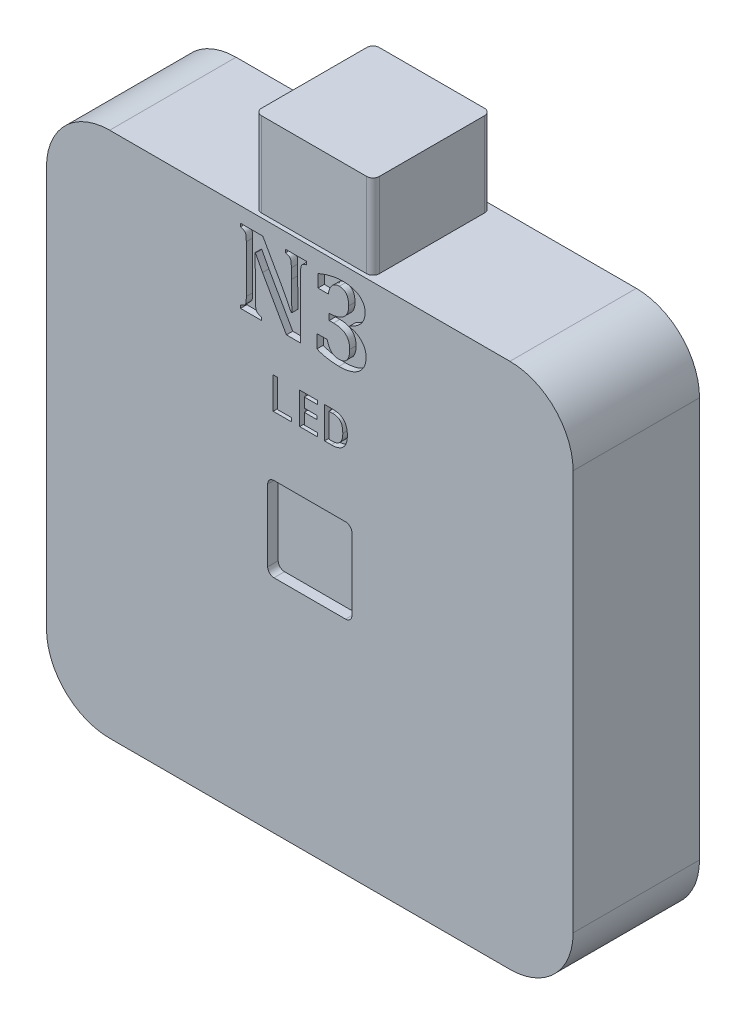
from build123d import *

# Parameters (mm, degrees)
MAIN_P_DEPTH     = 3
LED_P_DEPTH      = 0.5
N3_LED_P_DEPTH   = 0.3
CABLE_UP_P_DEPTH = 4
USB_P_DEPTH      = 5


with BuildPart() as part:
    # Main → Main_P (new, symmetric)
    with BuildSketch(Plane.XY):
        with BuildLine():
            Line((-12.5, 9.5), (-12.5, -9.5))
            ThreePointArc((-12.5, -9.5), (-11.621320344, -11.621320344), (-9.5, -12.5))
            Line((-9.5, -12.5), (9.5, -12.5))
            ThreePointArc((9.5, -12.5), (11.621320344, -11.621320344), (12.5, -9.5))
            Line((12.5, -9.5), (12.5, 9.5))
            ThreePointArc((12.5, 9.5), (11.621320344, 11.621320344), (9.5, 12.5))
            Line((9.5, 12.5), (-9.5, 12.5))
            ThreePointArc((-9.5, 12.5), (-11.621320344, 11.621320344), (-12.5, 9.5))
        make_face()
    extrude(amount=MAIN_P_DEPTH, both=True)

    # LED → LED_P (cut)
    with BuildSketch(Plane.XY.offset(3)):
        with BuildLine():
            ThreePointArc((-1.7, 2), (-1.912132034, 1.912132034), (-2, 1.7))
            Line((-2, 1.7), (-2, -1.7))
            ThreePointArc((-2, -1.7), (-1.912132034, -1.912132034), (-1.7, -2))
            Line((-1.7, -2), (1.7, -2))
            ThreePointArc((1.7, -2), (1.912132034, -1.912132034), (2, -1.7))
            Line((2, -1.7), (2, 1.7))
            ThreePointArc((2, 1.7), (1.912132034, 1.912132034), (1.7, 2))
            Line((1.7, 2), (-1.7, 2))
        make_face()
    extrude(amount=-LED_P_DEPTH, mode=Mode.SUBTRACT)

    # 草图3 → N3_LED_P (cut)
    # profile 1 of 5: a face of its own
    with BuildSketch(Plane.XY.offset(3)):
        with BuildLine():
            Line((-0.161653646, 11.781109518), (-0.161653646, 11.635276185))
            add(Edge.make_bspline(
                [(-0.161653646, 11.635276185), (-0.177669577, 11.630143703), (-0.207122243, 11.62070527), (-0.246900488, 11.605079733), (-0.279469724, 11.591737774), (-0.312906932, 11.575932284), (-0.347427448, 11.553100688), (-0.382321405, 11.516267884), (-0.408955266, 11.463747633), (-0.422918392, 11.407823862), (-0.431549055, 11.351158658), (-0.435554473, 11.295811772), (-0.438778121, 11.230222428), (-0.438850306, 11.182844202), (-0.438888889, 11.157520108)],
                knots=[0, 0, 0, 0, 0.975471235, 1.79385316, 2.478592115, 3.017303699, 3.938041953, 4.862988783, 5.927517867, 7.313751775, 8.190433857, 9.251714942, 10.531016607, 12, 12, 12, 12], degree=3))
            Line((-0.438888889, 11.157520108), (-0.438888889, 8.281109518))
            Line((-0.438888889, 8.281109518), (-1.109570312, 8.281109518))
            Line((-1.109570312, 8.281109518), (-2.243576389, 10.276443719))
            add(Edge.make_bspline(
                [(-2.243576389, 10.276443719), (-2.262061977, 10.30935546), (-2.297864844, 10.373098887), (-2.349981257, 10.466014814), (-2.397397164, 10.553857645), (-2.44170538, 10.636006813), (-2.48201379, 10.712701344), (-2.518234642, 10.783968671), (-2.551426649, 10.84954286), (-2.571291416, 10.891884411), (-2.580815972, 10.912185907)],
                knots=[0, 0, 0, 0, 1.258598321, 2.437651948, 3.551981321, 4.586832213, 5.549698172, 6.440681917, 7.252354063, 8, 8, 8, 8], degree=3))
            Line((-2.580815972, 10.912185907), (-2.603602431, 10.912185907))
            add(Edge.make_bspline(
                [(-2.603602431, 10.912185907), (-2.599591716, 10.81800995), (-2.59147488, 10.627417745), (-2.583113042, 10.337504552), (-2.578672736, 10.039985491), (-2.578078581, 9.838945123), (-2.577777778, 9.737164205)],
                knots=[0, 0, 0, 0, 0.96232484, 1.947541814, 2.960899847, 4, 4, 4, 4], degree=3))
            Line((-2.577777778, 9.737164205), (-2.577777778, 8.90317983))
            add(Edge.make_bspline(
                [(-2.577777778, 8.90317983), (-2.577360248, 8.873305826), (-2.576592183, 8.81835119), (-2.574303843, 8.743023002), (-2.568298325, 8.682170292), (-2.558638799, 8.621966077), (-2.535177858, 8.562565398), (-2.499072994, 8.513092269), (-2.457295753, 8.483552474), (-2.414642197, 8.463699144), (-2.361461312, 8.444163617), (-2.321902365, 8.432980934), (-2.300542535, 8.426942851)],
                knots=[0, 0, 0, 0, 1.438978439, 2.647068478, 3.627372042, 4.383140196, 5.576371536, 6.671434312, 7.273846566, 8.020909247, 8.931391092, 10, 10, 10, 10], degree=3))
            Line((-2.300542535, 8.426942851), (-2.300542535, 8.281109518))
            Line((-2.300542535, 8.281109518), (-3.289474826, 8.281109518))
            Line((-3.289474826, 8.281109518), (-3.289474826, 8.426942851))
            add(Edge.make_bspline(
                [(-3.289474826, 8.426942851), (-3.260887566, 8.435405948), (-3.209575028, 8.450596734), (-3.141898216, 8.480225141), (-3.089109373, 8.517166522), (-3.054582463, 8.569155916), (-3.031805913, 8.631573888), (-3.021267721, 8.708155169), (-3.015577407, 8.800531184), (-3.015384102, 8.86822464), (-3.015277778, 8.905458476)],
                knots=[0, 0, 0, 0, 1.149089374, 2.062551405, 2.843955622, 3.594533422, 4.429073491, 5.389328747, 6.564036866, 8, 8, 8, 8], degree=3))
            Line((-3.015277778, 8.905458476), (-3.015277778, 11.15676056))
            add(Edge.make_bspline(
                [(-3.015277778, 11.15676056), (-3.015325243, 11.186892755), (-3.015411829, 11.241859483), (-3.018334, 11.316860805), (-3.023087242, 11.376518256), (-3.032403199, 11.435206702), (-3.054104254, 11.494869379), (-3.091783318, 11.544237582), (-3.134117609, 11.575394999), (-3.176190741, 11.598027263), (-3.229205053, 11.618124618), (-3.268362891, 11.629268152), (-3.289474826, 11.635276185)],
                knots=[0, 0, 0, 0, 1.453211759, 2.650928568, 3.61941141, 4.338124492, 5.512963293, 6.643955544, 7.271627919, 8.036671964, 8.941472357, 10, 10, 10, 10], degree=3))
            Line((-3.289474826, 11.635276185), (-3.289474826, 11.781109518))
            Line((-3.289474826, 11.781109518), (-2.231423611, 11.781109518))
            Line((-2.231423611, 11.781109518), (-1.341232639, 10.204286601))
            add(Edge.make_bspline(
                [(-1.341232639, 10.204286601), (-1.326281235, 10.177203726), (-1.29419107, 10.119075811), (-1.242753958, 10.025182062), (-1.186516622, 9.917693152), (-1.103399271, 9.760024352), (-1.000819197, 9.561493992), (-0.925038386, 9.400153632), (-0.888541667, 9.322450664)],
                knots=[0, 0, 0, 0, 0.561655796, 1.205480602, 1.943652644, 2.764033489, 4.441529425, 6, 6, 6, 6], degree=3))
            Line((-0.888541667, 9.322450664), (-0.84828559, 9.322450664))
            add(Edge.make_bspline(
                [(-0.84828559, 9.322450664), (-0.852568567, 9.42801973), (-0.86132807, 9.643928572), (-0.870286692, 9.974860117), (-0.875728167, 10.319972333), (-0.876165667, 10.554689597), (-0.876388889, 10.674447192)],
                knots=[0, 0, 0, 0, 0.937488971, 1.917343447, 2.937385629, 4, 4, 4, 4], degree=3))
            Line((-0.876388889, 10.674447192), (-0.876388889, 11.156001011))
            add(Edge.make_bspline(
                [(-0.876388889, 11.156001011), (-0.8765491, 11.182077908), (-0.876846263, 11.230445989), (-0.878584804, 11.297370597), (-0.88341317, 11.352551665), (-0.889470731, 11.40804868), (-0.902414163, 11.461838736), (-0.926402611, 11.513437364), (-0.960023933, 11.5513147), (-0.994463834, 11.575841901), (-1.029168865, 11.592604982), (-1.062773812, 11.606857189), (-1.104258254, 11.621111424), (-1.134351907, 11.630312605), (-1.150585937, 11.635276185)],
                knots=[0, 0, 0, 0, 1.50660748, 2.794493175, 3.865833101, 4.705810794, 6.018377177, 7.045366401, 7.95762345, 8.91149549, 9.467497486, 10.181957038, 11.019256184, 12, 12, 12, 12], degree=3))
            Line((-1.150585937, 11.635276185), (-1.150585937, 11.781109518))
            Line((-1.150585937, 11.781109518), (-0.161653646, 11.781109518))
        make_face()
    # profile 2 of 5: a face of its own
    with BuildSketch(Plane.XY.offset(3)):
        with BuildLine():
            Line((0.3875, 10.954720629), (0.3875, 11.55552358))
            add(Edge.make_bspline(
                [(0.3875, 11.55552358), (0.440740019, 11.577509227), (0.544910562, 11.620526806), (0.701382153, 11.67600796), (0.853924181, 11.723162671), (1.002588814, 11.762188687), (1.147644136, 11.791995458), (1.288859262, 11.813238903), (1.426551741, 11.826815623), (1.517172623, 11.82876262), (1.561762153, 11.829720629)],
                knots=[0, 0, 0, 0, 1.138871734, 2.228340433, 3.281437788, 4.295392059, 5.266464412, 6.20817041, 7.11833965, 8, 8, 8, 8], degree=3))
            add(Edge.make_bspline(
                [(1.561762153, 11.829720629), (1.612700862, 11.828818436), (1.711831349, 11.827062702), (1.855946997, 11.810043084), (1.991078637, 11.782324938), (2.116218264, 11.742896491), (2.230784195, 11.693991601), (2.332778472, 11.634502441), (2.419627815, 11.562468262), (2.493671249, 11.481886216), (2.55197375, 11.390384121), (2.594306505, 11.289862871), (2.619025084, 11.17971571), (2.62204951, 11.103465747), (2.623611111, 11.064095629)],
                knots=[0, 0, 0, 0, 1.245991689, 2.424791773, 3.545045706, 4.616816666, 5.629595787, 6.587952593, 7.494614438, 8.380594144, 9.255347842, 10.135547138, 11.037327689, 12, 12, 12, 12], degree=3))
            add(Edge.make_bspline(
                [(2.623611111, 11.064095629), (2.622735968, 11.028066694), (2.621031018, 10.957875282), (2.60351275, 10.856007142), (2.57681259, 10.760264172), (2.537203389, 10.67174744), (2.48900985, 10.589026607), (2.431899461, 10.51188363), (2.364854414, 10.440894183), (2.289034787, 10.374315574), (2.202470426, 10.311815885), (2.105401044, 10.250288114), (1.996821144, 10.188580227), (1.91897061, 10.150440372), (1.878493924, 10.130610386)],
                knots=[0, 0, 0, 0, 1.018223358, 1.983698243, 2.915322269, 3.82284993, 4.718315375, 5.619291428, 6.531357531, 7.475260989, 8.469397413, 9.548207294, 10.725243872, 12, 12, 12, 12], degree=3))
            Line((1.878493924, 10.130610386), (1.878493924, 10.107823928))
            add(Edge.make_bspline(
                [(1.878493924, 10.107823928), (1.914332461, 10.100573361), (1.985268492, 10.086222149), (2.088345737, 10.054417236), (2.185825078, 10.011929471), (2.278699343, 9.962321579), (2.364496749, 9.903470268), (2.441580147, 9.834864416), (2.509481243, 9.757209764), (2.567266491, 9.670081548), (2.614853742, 9.575293169), (2.648343733, 9.472147921), (2.668374432, 9.361713423), (2.670917252, 9.285571619), (2.672222222, 9.246495803)],
                knots=[0, 0, 0, 0, 1.026010526, 2.030805963, 3.020916541, 4.0067071, 4.98253303, 5.933933234, 6.895997563, 7.869724968, 8.861364754, 9.863719257, 10.903665134, 12, 12, 12, 12], degree=3))
            add(Edge.make_bspline(
                [(2.672222222, 9.246495803), (2.670475833, 9.198772508), (2.66704771, 9.105092709), (2.639892184, 8.96867947), (2.594916044, 8.840381305), (2.541926714, 8.741209427), (2.491221993, 8.666758497), (2.448082435, 8.614099673), (2.400660821, 8.563973017), (2.347753383, 8.517937264), (2.291156171, 8.473615925), (2.229135573, 8.433475264), (2.162916446, 8.396210352), (2.067455524, 8.350000016), (1.936808858, 8.301935023), (1.766553096, 8.261373754), (1.580692314, 8.237026181), (1.451703991, 8.234044991), (1.384787326, 8.232498407)],
                knots=[0, 0, 0, 0, 1.238691166, 2.431524098, 3.596131476, 4.758044184, 5.339846471, 5.93341988, 6.524072501, 7.129652346, 7.75306838, 8.389559096, 9.046112197, 9.725450149, 11.142277535, 12.650970423, 14.262587788, 16, 16, 16, 16], degree=3))
            add(Edge.make_bspline(
                [(1.384787326, 8.232498407), (1.33716922, 8.233000944), (1.242335341, 8.234001772), (1.100704382, 8.244589066), (0.960201974, 8.260012504), (0.822458508, 8.283105417), (0.689307329, 8.310166445), (0.564478721, 8.345095257), (0.447273325, 8.381722131), (0.374357917, 8.413166248), (0.338888889, 8.428461949)],
                knots=[0, 0, 0, 0, 1.066585531, 2.124159315, 3.180226203, 4.232065357, 5.252166273, 6.22223498, 7.135222593, 8, 8, 8, 8], degree=3))
            Line((0.338888889, 8.428461949), (0.338888889, 9.058887296))
            Line((0.338888889, 9.058887296), (0.825, 9.058887296))
            add(Edge.make_bspline(
                [(0.825, 9.058887296), (0.837189747, 9.015014079), (0.860202393, 8.932187192), (0.907565053, 8.819827773), (0.960730451, 8.725473619), (1.023417455, 8.650027003), (1.096067092, 8.592546026), (1.17921829, 8.55307138), (1.27189704, 8.527622129), (1.337265875, 8.52534449), (1.371115451, 8.524165074)],
                knots=[0, 0, 0, 0, 1.305930177, 2.46542516, 3.491309853, 4.404185451, 5.263440125, 6.128056862, 7.030662191, 8, 8, 8, 8], degree=3))
            add(Edge.make_bspline(
                [(1.371115451, 8.524165074), (1.392164121, 8.524433805), (1.433176166, 8.524957413), (1.492609065, 8.53390272), (1.548059007, 8.546568938), (1.599916425, 8.563781846), (1.646929411, 8.587859054), (1.690785253, 8.615684602), (1.729796272, 8.649783266), (1.765072714, 8.688559859), (1.795252278, 8.733144058), (1.822079278, 8.782170178), (1.84498521, 8.836294062), (1.86284081, 8.89598753), (1.877484799, 8.960655912), (1.886829861, 9.030567503), (1.893110212, 9.1053591), (1.893990014, 9.156854944), (1.894444444, 9.183453268)],
                knots=[0, 0, 0, 0, 1.04932923, 2.044553753, 2.991534269, 3.886518749, 4.762302477, 5.620875306, 6.471885114, 7.33961212, 8.229767994, 9.151377203, 10.125200033, 11.156267991, 12.256683227, 13.430583075, 14.672860224, 16, 16, 16, 16], degree=3))
            add(Edge.make_bspline(
                [(1.894444444, 9.183453268), (1.893923242, 9.212094329), (1.89291031, 9.267756915), (1.883337619, 9.348187978), (1.86974041, 9.423238576), (1.847881869, 9.491942686), (1.821530947, 9.555576976), (1.788878631, 9.613655138), (1.749657985, 9.66586494), (1.704456283, 9.71249025), (1.653392593, 9.753918462), (1.595481177, 9.788663397), (1.532454678, 9.819445748), (1.462480649, 9.84356268), (1.386682245, 9.862203917), (1.304717529, 9.876142531), (1.216545131, 9.883216945), (1.155667314, 9.884575397), (1.124262153, 9.885276185)],
                knots=[0, 0, 0, 0, 1.148071931, 2.231225072, 3.24480356, 4.201827953, 5.116438562, 6.003060875, 6.866114256, 7.727792825, 8.601530905, 9.494871905, 10.430378815, 11.409816751, 12.456422708, 13.558120058, 14.740302521, 16, 16, 16, 16], degree=3))
            Line((1.124262153, 9.885276185), (0.922222222, 9.885276185))
            Line((0.922222222, 9.885276185), (0.922222222, 10.176942851))
            add(Edge.make_bspline(
                [(0.922222222, 10.176942851), (0.958968977, 10.179047578), (1.030367567, 10.183137041), (1.133861524, 10.196149192), (1.23055265, 10.214228929), (1.320626575, 10.237464771), (1.403485769, 10.267000531), (1.479437046, 10.302240842), (1.548758592, 10.342427601), (1.611744672, 10.387864156), (1.666592564, 10.440159976), (1.714960843, 10.497177798), (1.755313557, 10.560217187), (1.789037602, 10.628097219), (1.814991128, 10.701808441), (1.832889709, 10.780828418), (1.84365028, 10.865304662), (1.845090515, 10.92329325), (1.845833333, 10.953201532)],
                knots=[0, 0, 0, 0, 1.294124326, 2.514471056, 3.665273782, 4.75157949, 5.782351101, 6.754339568, 7.691995305, 8.596689159, 9.478484644, 10.35060716, 11.219952716, 12.103948147, 13.010742687, 13.961079669, 14.948403386, 16, 16, 16, 16], degree=3))
            add(Edge.make_bspline(
                [(1.845833333, 10.953201532), (1.845601673, 10.976502984), (1.845150288, 11.021905495), (1.839954798, 11.087649363), (1.83057941, 11.148966268), (1.818822186, 11.205961214), (1.803003196, 11.258682836), (1.782835695, 11.306707618), (1.760733292, 11.351079808), (1.73337706, 11.389994358), (1.704254924, 11.425255015), (1.670709149, 11.455221946), (1.634583481, 11.481320037), (1.594305126, 11.501550057), (1.551844133, 11.518784688), (1.505510174, 11.529871196), (1.456147632, 11.536840966), (1.422030494, 11.537642794), (1.40453559, 11.538053962)],
                knots=[0, 0, 0, 0, 1.342415624, 2.615675512, 3.795773904, 4.914495864, 5.966655767, 6.960891649, 7.913479791, 8.815817395, 9.695585522, 10.542445334, 11.400538855, 12.255277765, 13.132987386, 14.03520706, 14.992475158, 16, 16, 16, 16], degree=3))
            add(Edge.make_bspline(
                [(1.40453559, 11.538053962), (1.384491939, 11.53754342), (1.344910756, 11.536535226), (1.286744903, 11.526292289), (1.230852682, 11.509562789), (1.177220657, 11.485709854), (1.12508323, 11.454589705), (1.077488635, 11.411845023), (1.032105503, 11.360106931), (0.989775583, 11.298597965), (0.951803541, 11.227101967), (0.920110747, 11.145095851), (0.892637928, 11.053754417), (0.880107507, 10.9885341), (0.873611111, 10.954720629)],
                knots=[0, 0, 0, 0, 0.831492998, 1.641990067, 2.443438678, 3.248189408, 4.073881454, 4.952981561, 5.891417605, 6.926545987, 8.045740153, 9.244265423, 10.571289508, 12, 12, 12, 12], degree=3))
            Line((0.873611111, 10.954720629), (0.3875, 10.954720629))
        make_face()
    # profile 3 of 5: a face of its own
    with BuildSketch(Plane.XY.offset(3)):
        Polygon((-0.869565217, 4.825678085), (-1.739130435, 4.825678085), (-1.739130435, 6.325678085), (-1.52173913, 6.325678085), (-1.52173913, 4.999591128), (-0.869565217, 4.999591128), align=None)
    # profile 4 of 5: a face of its own
    with BuildSketch(Plane.XY.offset(3)):
        Polygon((0.369565217, 4.825678085), (-0.47826087, 4.825678085), (-0.47826087, 6.325678085), (0.369565217, 6.325678085), (0.369565217, 6.151765041), (-0.260869565, 6.151765041), (-0.260869565, 5.695243302), (0.344429348, 5.695243302), (0.344429348, 5.521330259), (-0.260869565, 5.521330259), (-0.260869565, 4.999591128), (0.369565217, 4.999591128), align=None)
    # profile 5 of 5: a face of its own
    with BuildSketch(Plane.XY.offset(3)):
        with BuildLine():
            add(Edge.make_bspline(
                [(1.782608696, 5.592322107), (1.781881693, 5.557071296), (1.780453249, 5.487809132), (1.769639022, 5.402697551), (1.757030821, 5.337344625), (1.744778972, 5.290636145), (1.730148703, 5.245451149), (1.712869427, 5.202118691), (1.693087326, 5.160443807), (1.670777532, 5.120529234), (1.645105156, 5.082959727), (1.617340404, 5.046999069), (1.586239261, 5.013529079), (1.55176278, 4.982547568), (1.513983946, 4.953939128), (1.472709687, 4.928053631), (1.428019143, 4.905147805), (1.380326169, 4.884093241), (1.328856141, 4.866699984), (1.273999358, 4.851672582), (1.215487151, 4.839669642), (1.153019868, 4.83187259), (1.086821989, 4.826554805), (1.041338254, 4.825975367), (1.018002717, 4.825678085)],
                knots=[0, 0, 0, 0, 1.874627119, 3.68334034, 4.55511198, 5.414139205, 6.25033141, 7.080252411, 7.893905149, 8.703019486, 9.509911256, 10.312362027, 11.117881282, 11.936734267, 12.775179546, 13.635831221, 14.524848569, 15.444673208, 16.406604644, 17.411911457, 18.469143348, 19.580838344, 20.758843452, 22, 22, 22, 22], degree=3))
            Line((1.018002717, 4.825678085), (0.695652174, 4.825678085))
            Line((0.695652174, 4.825678085), (0.695652174, 6.325678085))
            Line((0.695652174, 6.325678085), (1.083559783, 6.325678085))
            add(Edge.make_bspline(
                [(1.083559783, 6.325678085), (1.112000472, 6.325210637), (1.167205562, 6.324303293), (1.247203115, 6.315771362), (1.321614986, 6.30153098), (1.390592594, 6.282111252), (1.453838666, 6.256436711), (1.511742055, 6.225622096), (1.563859575, 6.188578649), (1.610414006, 6.145786933), (1.651504473, 6.097246892), (1.686641012, 6.042511604), (1.716612678, 5.982038736), (1.741038601, 5.915527283), (1.759476359, 5.842962668), (1.772951489, 5.764723032), (1.781180102, 5.680473029), (1.782122124, 5.622345867), (1.782608696, 5.592322107)],
                knots=[0, 0, 0, 0, 1.17177347, 2.274482801, 3.310388109, 4.291013938, 5.222472681, 6.118087065, 6.988127256, 7.850034114, 8.717518086, 9.601485366, 10.523818561, 11.493740021, 12.515690363, 13.604990885, 14.762933224, 16, 16, 16, 16], degree=3))
        make_face()
        with BuildLine():
            add(Edge.make_bspline(
                [(1.565217391, 5.574998737), (1.564942283, 5.600597445), (1.564413293, 5.649819846), (1.559006206, 5.72050339), (1.549966202, 5.785095837), (1.537269437, 5.843787056), (1.520513695, 5.896701404), (1.500812547, 5.944568744), (1.476103757, 5.986462703), (1.448035269, 6.023535183), (1.41582989, 6.055206124), (1.37998254, 6.082555478), (1.340199693, 6.104942915), (1.296431336, 6.122241928), (1.249111655, 6.135293061), (1.1980606, 6.145365053), (1.142879255, 6.150452204), (1.104854455, 6.15131856), (1.085258152, 6.151765041)],
                knots=[0, 0, 0, 0, 1.413547595, 2.71803587, 3.911871408, 5.013341294, 6.029850817, 6.974090411, 7.865305992, 8.708270035, 9.535123508, 10.351794371, 11.191784495, 12.047569406, 12.944296091, 13.8996306, 14.91756238, 16, 16, 16, 16], degree=3))
            Line((1.085258152, 6.151765041), (0.913043478, 6.151765041))
            Line((0.913043478, 6.151765041), (0.913043478, 4.999591128))
            Line((0.913043478, 4.999591128), (1.062839674, 4.999591128))
            add(Edge.make_bspline(
                [(1.062839674, 4.999591128), (1.083119777, 5.000098955), (1.122540429, 5.001086073), (1.179823302, 5.007233415), (1.232969226, 5.018977041), (1.282313121, 5.034521063), (1.327867865, 5.054457277), (1.369231205, 5.079585621), (1.407048253, 5.108823381), (1.44029475, 5.143228176), (1.470310154, 5.181482487), (1.49564387, 5.224719414), (1.517491997, 5.272122957), (1.535090611, 5.324060024), (1.548537836, 5.380487759), (1.558324612, 5.441335212), (1.564040428, 5.506728193), (1.564817043, 5.551776255), (1.565217391, 5.574998737)],
                knots=[0, 0, 0, 0, 1.112402768, 2.162298815, 3.153767855, 4.092494856, 4.996014567, 5.873553179, 6.740614794, 7.610074679, 8.4907496, 9.401305331, 10.351566166, 11.349161427, 12.403455731, 13.529502205, 14.72644707, 16, 16, 16, 16], degree=3))
        make_face(mode=Mode.SUBTRACT)
    extrude(amount=-N3_LED_P_DEPTH, mode=Mode.SUBTRACT)

    # 草图4 → Cable_up_P (add)
    with BuildSketch(Plane(origin=(0, 12.5, 0), x_dir=(1, 0, 0), z_dir=(0, 1, 0))):
        with BuildLine():
            Line((-2.5, 2.8), (2.5, 2.8))
            ThreePointArc((2.5, 2.8), (2.712132034, 2.712132034), (2.8, 2.5))
            Line((2.8, 2.5), (2.8, -2.5))
            ThreePointArc((2.8, -2.5), (2.712132034, -2.712132034), (2.5, -2.8))
            Line((2.5, -2.8), (-2.5, -2.8))
            ThreePointArc((-2.5, -2.8), (-2.712132034, -2.712132034), (-2.8, -2.5))
            Line((-2.8, -2.5), (-2.8, 2.5))
            ThreePointArc((-2.8, 2.5), (-2.712132034, 2.712132034), (-2.5, 2.8))
        make_face()
    extrude(amount=CABLE_UP_P_DEPTH)

    # 草图5 → USB_P (cut)
    with BuildSketch(Plane.XZ.offset(12.5)):
        Polygon((-3.25, -0.8), (3.25, -0.8), (3.25, 0), (2.5, 1.2), (-2.5, 1.2), (-3.25, 0), align=None)
    extrude(amount=-USB_P_DEPTH, mode=Mode.SUBTRACT)


solid = part.part
